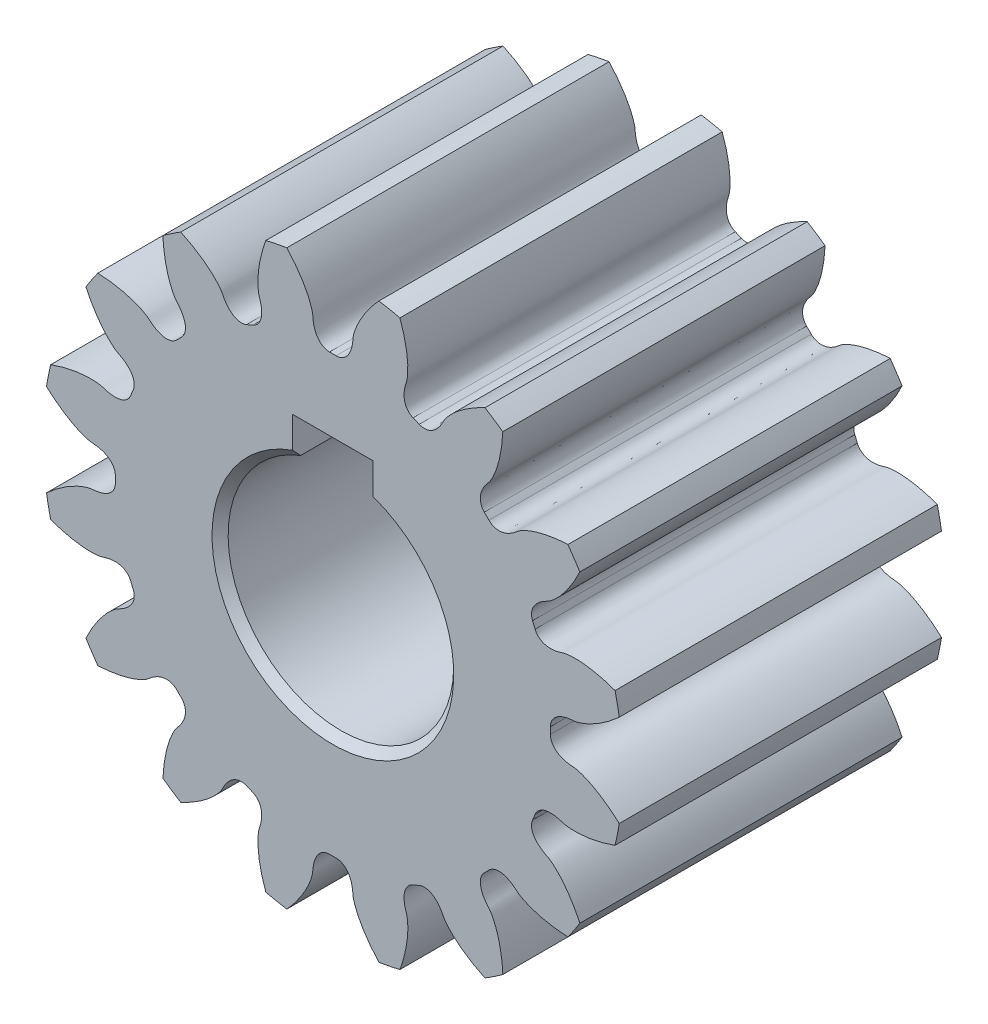
from build123d import *

# Parameters (mm, degrees)
GEAR_BASESKETCH_R                            = 18
F_2_0_32_0000MM_P_D_DEPTH                    = 10
TOOTH_CUT_COARSE_PITCH_INVOLUTE_20_DEG_DEPTH = 28.349588662
PATTERN_CIRCULAR_1_COUNT                     = 16
SKETCH_3_R                                   = 7
CUT_EXTRUDE_2_DEPTH                          = 100
SKETCH_4_W                                   = 5
SKETCH_4_H                                   = 6.794133138
CUT_EXTRUDE_3_DEPTH                          = 33.119626042
CHAMFER_1_SIZE                               = 0.5


with BuildPart() as part:
    # Gear-BaseSketch → 2.0 模数    , 32.0000mm P.D. (new, symmetric)
    with BuildSketch(Plane.XY):
        Circle(GEAR_BASESKETCH_R)
    extrude(amount=F_2_0_32_0000MM_P_D_DEPTH, both=True)

    # Tooth-Sketch; Backlash: 0.0000mm → Tooth-Cut, Coarse Pitch Involute 20 deg (cut, symmetric)
    with BuildSketch(Plane.XY):
        with BuildLine():
            ThreePointArc((-2.927767296, 17.848938419), (0, 18.087465937), (2.927767296, 17.848938419))
            add(Edge.make_bspline(
                [(2.927767296, 17.848938419), (2.83039144, 17.742225279), (2.642355304, 17.536158527), (2.387419097, 17.223226312), (2.163656894, 16.923988256), (1.970447406, 16.639628975), (1.805714518, 16.372447928), (1.667576663, 16.124315922), (1.553962157, 15.897032839), (1.462723236, 15.692235063), (1.391580057, 15.511413191), (1.338267015, 15.355891572), (1.300159032, 15.226856156), (1.275333612, 15.125263761), (1.248084755, 14.99598502), (1.245257445, 14.86190718), (1.228636088, 14.719097213), (1.213093506, 14.614328022), (1.187469219, 14.481291895), (1.146245155, 14.322774913), (1.079457003, 14.142811976), (0.992786035, 13.974126067), (0.880068348, 13.816137915), (0.731521281, 13.672104412), (0.537162803, 13.554937788), (0.350590724, 13.505244001), (0.235593484, 13.499963003), (0.203121972, 13.49847182)],
                knots=[0, 0, 0, 0, 0.080649556, 0.155737074, 0.225262555, 0.289225997, 0.347627401, 0.400466768, 0.447744097, 0.489459389, 0.525612643, 0.55620386, 0.58123304, 0.600700185, 0.614605295, 0.654901533, 0.675197565, 0.694889465, 0.714022376, 0.750828538, 0.786203906, 0.820995833, 0.856423807, 0.894111503, 0.935742083, 0.981855637, 1, 1, 1, 1], degree=3))
            ThreePointArc((0.203121972, 13.49847182), (0, 13.5), (-0.203121972, 13.49847182))
            add(Edge.make_bspline(
                [(-2.927767296, 17.848938419), (-2.83039144, 17.742225279), (-2.642355304, 17.536158527), (-2.387419097, 17.223226312), (-2.163656894, 16.923988256), (-1.970447406, 16.639628975), (-1.805714518, 16.372447928), (-1.667576663, 16.124315922), (-1.553962157, 15.897032839), (-1.462723236, 15.692235063), (-1.391580057, 15.511413191), (-1.338267015, 15.355891572), (-1.300159032, 15.226856156), (-1.275333612, 15.125263761), (-1.248084755, 14.99598502), (-1.245257445, 14.86190718), (-1.228636088, 14.719097213), (-1.213093506, 14.614328022), (-1.187469219, 14.481291895), (-1.146245155, 14.322774913), (-1.079457003, 14.142811976), (-0.992786035, 13.974126067), (-0.880068348, 13.816137915), (-0.731521281, 13.672104412), (-0.537162803, 13.554937788), (-0.350590724, 13.505244001), (-0.235593484, 13.499963003), (-0.203121972, 13.49847182)],
                knots=[0, 0, 0, 0, 0.080649556, 0.155737074, 0.225262555, 0.289225997, 0.347627401, 0.400466768, 0.447744097, 0.489459389, 0.525612643, 0.55620386, 0.58123304, 0.600700185, 0.614605295, 0.654901533, 0.675197565, 0.694889465, 0.714022376, 0.750828538, 0.786203906, 0.820995833, 0.856423807, 0.894111503, 0.935742083, 0.981855637, 1, 1, 1, 1], degree=3))
        make_face()
    tooth_cut_coarse_pitch_involute_20_deg = extrude(amount=TOOTH_CUT_COARSE_PITCH_INVOLUTE_20_DEG_DEPTH, both=True, mode=Mode.SUBTRACT)

    # 阵列(圆周)1: Tooth-Cut, Coarse Pitch Involute 20 deg ×16 about axis
    pattern_circular_1_axis = Axis((0, 0, -88.99), (0, 0, 1))
    for i in range(1, PATTERN_CIRCULAR_1_COUNT):
        add(tooth_cut_coarse_pitch_involute_20_deg.rotate(pattern_circular_1_axis, i * 360 / PATTERN_CIRCULAR_1_COUNT), mode=Mode.SUBTRACT)

    # 草图3 → 切除-拉伸2 (cut)
    with BuildSketch(Plane.XY.offset(10)):
        Circle(SKETCH_3_R)
    extrude(amount=-CUT_EXTRUDE_2_DEPTH, mode=Mode.SUBTRACT)

    # 草图4 → 切除-拉伸3 (cut, through all)
    with BuildSketch(Plane(origin=(0, 0, -10), x_dir=(-1, 0, 0), z_dir=(0, 0, -1))):
        with Locations((0, 5.602933431)):
            Rectangle(SKETCH_4_W, SKETCH_4_H)
    extrude(amount=-CUT_EXTRUDE_3_DEPTH, mode=Mode.SUBTRACT)

    # 倒角1
    chamfer_1_edges = [part.edges().sort_by_distance(p)[0] for p in [
        (0, -7, 10),
        (0, -7, -10),
    ]]
    chamfer(chamfer_1_edges, length=CHAMFER_1_SIZE)


solid = part.part
